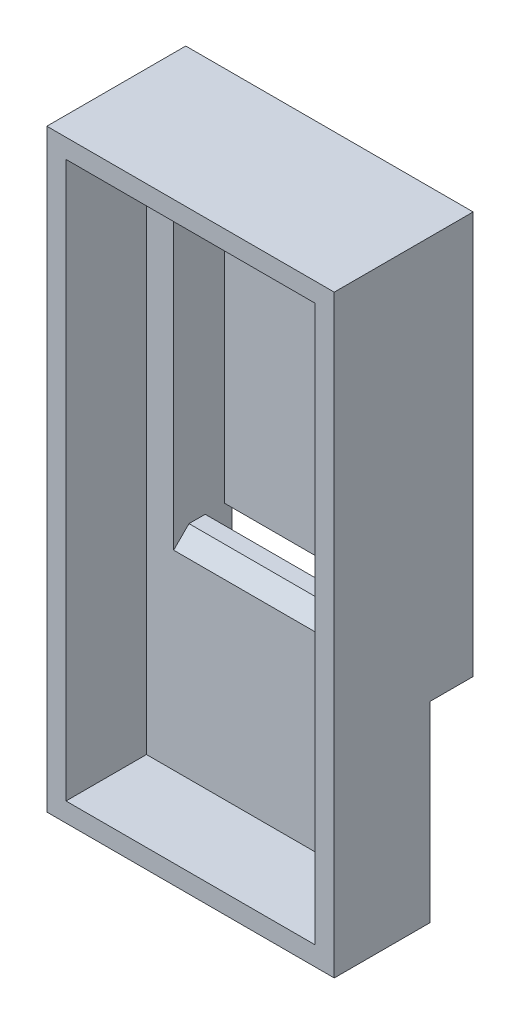
from build123d import *

# Parameters (mm, degrees)
SKETCH4_W           = 29.99999933
SKETCH4_H           = 41.999999434
BOSS_EXTRUDE2_DEPTH = 4.499999806
SKETCH5_W           = 1.862979494
SKETCH5_H           = 40.647998452
CUT_EXTRUDE1_DEPTH  = 2.068
SKETCH2_W           = 1.025000587
SKETCH2_H           = 2.855999861
SKETCH2_H_2         = 2.855997533
CUT_EXTRUDE2_DEPTH  = 2.068
SKETCH3_W           = 1.025000587
SKETCH3_H           = 7.699999958
SKETCH3_H_2         = 7.699999959
CUT_EXTRUDE3_DEPTH  = 1.251
SKETCH6_W           = 8.999999612
SKETCH6_H           = 2.000000328
CUT_EXTRUDE4_DEPTH  = 1
SKETCH7_W           = 20.324639976
SKETCH7_H           = 3.493499942
CUT_EXTRUDE6_DEPTH  = 2.81
CUT_EXTRUDE7_DEPTH  = 3.699999806
SKETCH9_W           = 29.99999933
SKETCH9_H           = 61.999998987
SKETCH9_W_2         = 20.324639976
SKETCH9_H_2         = 36.506499492
BOSS_EXTRUDE3_DEPTH = 10
SKETCH10_W          = 25.99999933
SKETCH10_H          = 57.999998987
CUT_EXTRUDE8_DEPTH  = 8.4
CHAMFER1_SIZE       = 1.6


# Read off the part's stored shape, not the designer's step: Surface-Imported1
with BuildPart() as part:
    # Sketch4 → Boss-Extrude2 (new body)
    with BuildSketch(Plane.XY):
        with Locations((0, 20.999999717)):
            Rectangle(SKETCH4_W, SKETCH4_H)
    extrude(amount=BOSS_EXTRUDE2_DEPTH)

    # Sketch5 → Cut-Extrude1 (cut)
    with BuildSketch(Plane.XY):
        with Locations((-12.198510114, 20.323999226)):
            Rectangle(SKETCH5_W, SKETCH5_H)
        with Locations((12.198510114, 20.323999226)):
            Rectangle(SKETCH5_W, SKETCH5_H)
    extrude(amount=CUT_EXTRUDE1_DEPTH, mode=Mode.SUBTRACT)

    # Sketch2 → Cut-Extrude2 (cut)
    with BuildSketch(Plane.XY):
        with Locations((13.642500155, 4.677999998)):
            Rectangle(SKETCH2_W, SKETCH2_H)
        with Locations((13.642500155, 24.677999318)):
            Rectangle(SKETCH2_W, SKETCH2_H_2)
    extrude(amount=CUT_EXTRUDE2_DEPTH, mode=Mode.SUBTRACT)

    # Sketch3 → Cut-Extrude3 (cut)
    with BuildSketch(Plane.XY.offset(0.816999993)):
        with Locations((13.642500155, 7.100000046)):
            Rectangle(SKETCH3_W, SKETCH3_H)
        with Locations((13.642500155, 27.100000531)):
            Rectangle(SKETCH3_W, SKETCH3_H_2)
    extrude(amount=CUT_EXTRUDE3_DEPTH, mode=Mode.SUBTRACT)

    # Sketch6 → Cut-Extrude4 (cut)
    with BuildSketch(Plane.XY):
        with Locations((0, 31.999999657)):
            Rectangle(SKETCH6_W, SKETCH6_H)
    extrude(amount=CUT_EXTRUDE4_DEPTH, mode=Mode.SUBTRACT)

    # Sketch7 → Cut-Extrude6 (cut)
    with BuildSketch(Plane.XY):
        with Locations((0, 1.746749971)):
            Rectangle(SKETCH7_W, SKETCH7_H)
    extrude(amount=CUT_EXTRUDE6_DEPTH, mode=Mode.SUBTRACT)

    # Sketch8 → Cut-Extrude7 (cut)
    with BuildSketch(Plane.XY.offset(4.499999806)):
        Polygon((-9.362319988, 3.493499942), (-10.162319988, 3.493499942), (-10.162319988, 39.999999434), (10.162319988, 39.999999434), (10.162319988, 3.493499942), (9.362319988, 3.493499942), align=None)
    extrude(amount=-CUT_EXTRUDE7_DEPTH, mode=Mode.SUBTRACT)

    # Sketch9 → Boss-Extrude3 (add)
    with BuildSketch(Plane.XY.offset(4.499999806)):
        with Locations((0, 10.999999941)):
            Rectangle(SKETCH9_W, SKETCH9_H)
        with Locations((0, 21.746749688)):
            Rectangle(SKETCH9_W_2, SKETCH9_H_2, mode=Mode.SUBTRACT)
    extrude(amount=BOSS_EXTRUDE3_DEPTH)

    # Sketch10 → Cut-Extrude8 (cut)
    with BuildSketch(Plane.XY.offset(14.499999806)):
        with Locations((0, 10.999999941)):
            Rectangle(SKETCH10_W, SKETCH10_H)
    extrude(amount=-CUT_EXTRUDE8_DEPTH, mode=Mode.SUBTRACT)

    # Chamfer1
    chamfer1_edges = [part.edges().sort_by_distance(p)[0] for p in [
        (0, 3.493499942, 6.099999806),
    ]]
    chamfer(chamfer1_edges, length=CHAMFER1_SIZE)


with BuildPart() as body_2:
    # Split1: the piece on the far side of the plane
    add(part.part)
    split(bisect_by=Plane(origin=(0, 0, 0), x_dir=(0, 0, 1), z_dir=(1, 0, 0)), keep=Keep.BOTTOM)


with BuildPart() as part_1:
    add(part.part)

    # Split1
    split(bisect_by=Plane(origin=(0, 0, 0), x_dir=(0, 0, 1), z_dir=(1, 0, 0)), keep=Keep.TOP)

    # Mirror1: part across plane


with BuildPart() as part_2:
    add(part_1.part)
    add(part_1.part.mirror(Plane(origin=(0, 0, 0), x_dir=(0, 0, 1), z_dir=(1, 0, 0))))


solid = part_2.part
